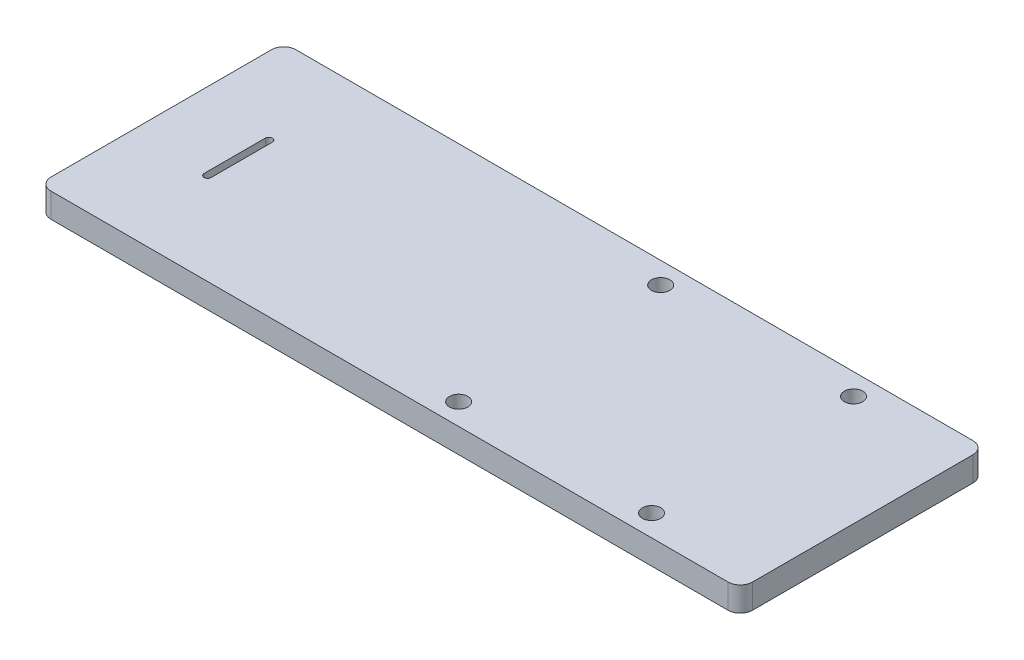
from build123d import *

# Parameters (mm, degrees)
SKETCH1_W           = 363.80000011
SKETCH1_H           = 127
BOSS_EXTRUDE1_DEPTH = 12.7
FILLET1_R           = 6.35
SKETCH2_R           = 4.7752
CUT_EXTRUDE1_DEPTH  = 194.083272243
CUT_EXTRUDE2_REACH  = 195.083


with BuildPart() as part:
    # Sketch1 → Boss-Extrude1 (new body)
    with BuildSketch(Plane(origin=(0, 0, 0), x_dir=(1, 0, 0), z_dir=(0, 1, 0))):
        Rectangle(SKETCH1_W, SKETCH1_H)
    extrude(amount=BOSS_EXTRUDE1_DEPTH)

    # Fillet1
    fillet1_edges = [part.edges().sort_by_distance(p)[0] for p in [
        (-181.900000055, 6.35, -63.5),
        (181.900000055, 6.35, -63.5),
        (181.900000055, 6.35, 63.5),
        (-181.900000055, 6.35, 63.5),
    ]]
    fillet(fillet1_edges, radius=FILLET1_R)

    # Sketch2 → Cut-Extrude1 (cut, through all)
    with BuildSketch(Plane(origin=(0, 12.7, 0), x_dir=(1, 0, 0), z_dir=(0, 1, 0))):
        with Locations((24.729999943, 52.3748)):
            Circle(SKETCH2_R)
        with Locations((24.729999943, -52.3748)):
            Circle(SKETCH2_R)
        with Locations((124.750000055, -52.3748)):
            Circle(SKETCH2_R)
        with Locations((124.750000055, 52.3748)):
            Circle(SKETCH2_R)
    extrude(amount=-CUT_EXTRUDE1_DEPTH, mode=Mode.SUBTRACT)

    # Sketch3 → Cut-Extrude2 (cut, up to next)
    with BuildSketch(Plane.XZ, mode=Mode.PRIVATE) as cut_extrude2_sk1:
        with BuildLine():
            Line((-140.146421401, 15.875), (-140.146421401, -15.875))
            ThreePointArc((-140.146421401, -15.875), (-141.975278712, -17.703857312), (-143.804136024, -15.875))
            Line((-143.804136024, -15.875), (-143.804136024, 15.875))
            ThreePointArc((-143.804136024, 15.875), (-141.975278712, 17.703857312), (-140.146421401, 15.875))
        make_face()
    cut_extrude2_tool1 = extrude(cut_extrude2_sk1.sketch, amount=-CUT_EXTRUDE2_REACH, mode=Mode.PRIVATE) & part.part
    add(cut_extrude2_tool1.solids().sort_by_distance((-141.975279, 0, 0))[0], mode=Mode.SUBTRACT)


solid = part.part
